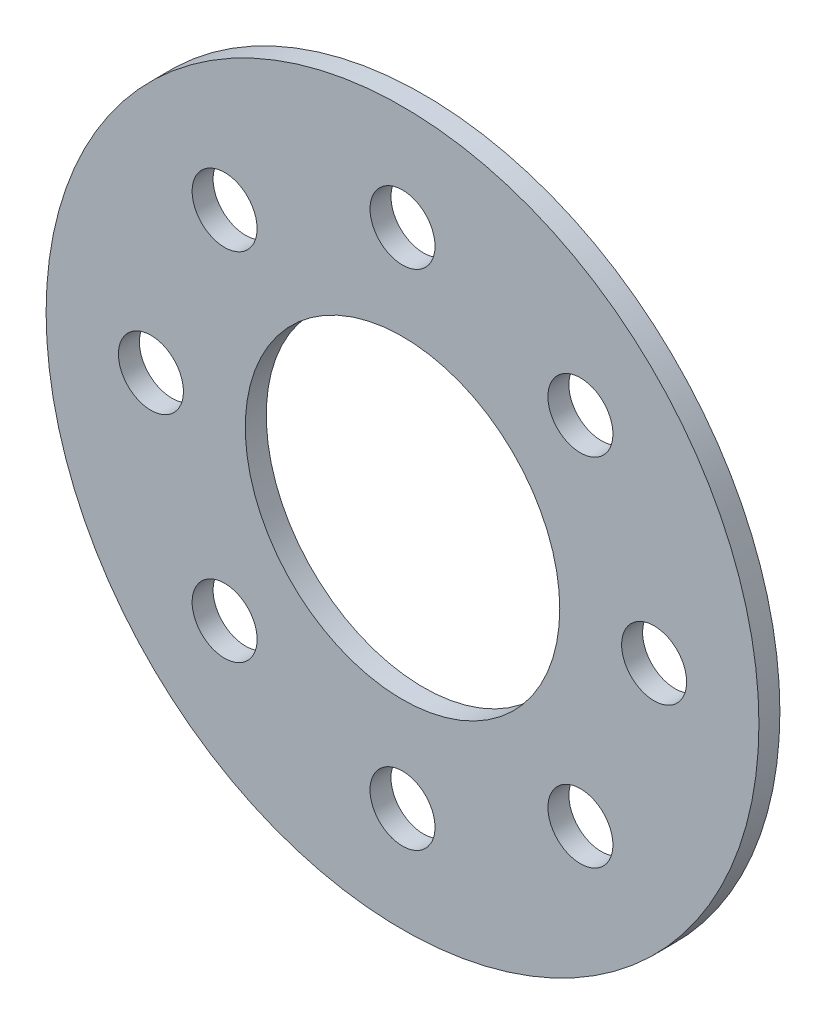
from build123d import *

# Parameters (mm, degrees)
SKETCH1_R           = 17
SKETCH1_R_2         = 7.5
BOSS_EXTRUDE1_DEPTH = 1
SKETCH2_R           = 1.55
CUT_EXTRUDE1_DEPTH  = 25.062418831
CIRPATTERN1_COUNT   = 8


with BuildPart() as part:
    # Sketch1 → Boss-Extrude1 (new body)
    with BuildSketch(Plane.XY):
        Circle(SKETCH1_R)
        Circle(SKETCH1_R_2, mode=Mode.SUBTRACT)
    extrude(amount=BOSS_EXTRUDE1_DEPTH)

    # Sketch2 → Cut-Extrude1 (cut, symmetric)
    with BuildSketch(Plane.XY.offset(1)):
        with Locations((0, 12)):
            Circle(SKETCH2_R)
    cut_extrude1 = extrude(amount=CUT_EXTRUDE1_DEPTH, both=True, mode=Mode.SUBTRACT)

    # CirPattern1: Cut-Extrude1 ×8 about axis
    cirpattern1_axis = Axis((0, 0, 1), (0, 0, -1))
    for i in range(1, CIRPATTERN1_COUNT):
        add(cut_extrude1.rotate(cirpattern1_axis, i * 360 / CIRPATTERN1_COUNT), mode=Mode.SUBTRACT)


solid = part.part
